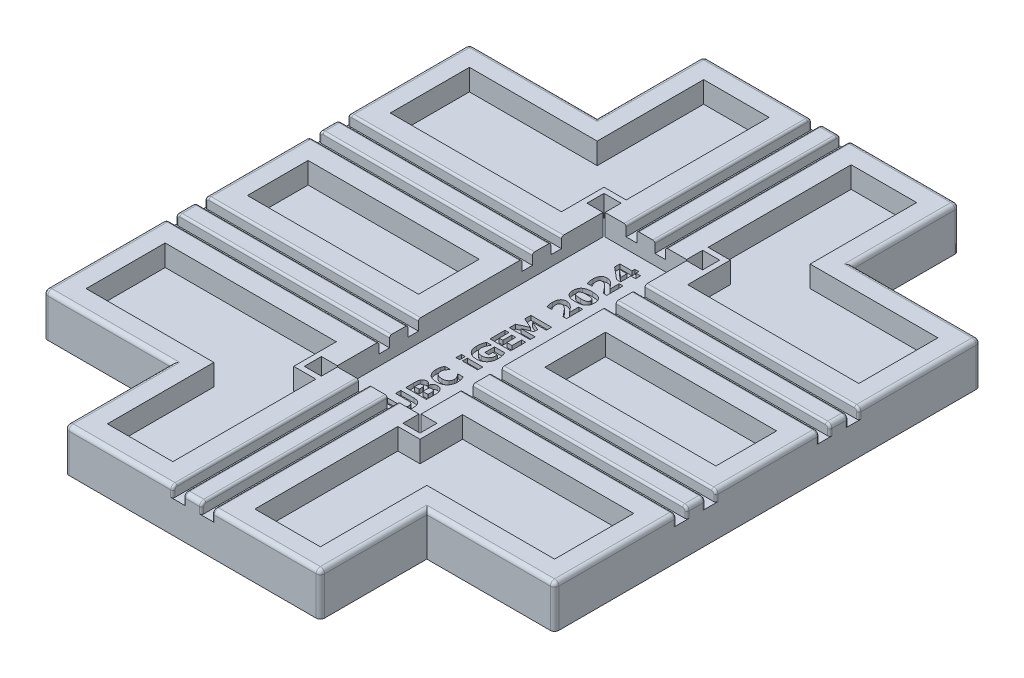
from build123d import *

# Parameters (mm, degrees)
SKETCH1_W                                  = 240
SKETCH1_H                                  = 200
BOSS_EXTRUDE1_DEPTH                        = 20
SKETCH7_W                                  = 120
SKETCH7_H                                  = 50
BOSS_EXTRUDE6_DEPTH                        = 20
FILLET1_R                                  = 2
SKETCH2_W                                  = 39.3
SKETCH2_H                                  = 125.7
CUT_EXTRUDE1_DEPTH                         = 10
CUT_EXTRUDE3_DEPTH                         = 5
MIRROR4_AT_THE_SECOND_PLANE_COPY_1_DEPTH   = 5
SKETCH11_W                                 = 104.748042719
SKETCH11_H                                 = 5
CUT_EXTRUDE4_DEPTH                         = 5
MIRROR6_AT_THE_SECOND_PLANE_COPY_1_SKETC_W = 104.748042719
MIRROR6_AT_THE_SECOND_PLANE_COPY_1_SKETC_H = 5
MIRROR6_AT_THE_SECOND_PLANE_COPY_1_DEPTH   = 5
SHELL1_START                               = 10
SHELL1_OUTLINE_W                           = 80.35
SHELL1_OUTLINE_H                           = 28.5
SHELL1_DEPTH                               = 10
FILLET3_R                                  = 1
SKETCH13_W                                 = 7.252545243
SKETCH13_H                                 = 2.335565418
SKETCH13_W_2                               = 1.720942939
SKETCH13_H_2                               = 2.581414408
CUT_EXTRUDE5_DEPTH                         = 2
CUT_EXTRUDE6_DEPTH                         = 10
MIRROR7_AT_THE_SECOND_PLANE_COPY_1_DEPTH   = 10


# Read off the part's stored shape, not the designer's step: Shell1
with BuildPart() as part:
    # Sketch1 → Boss-Extrude1 (new body)
    with BuildSketch(Plane(origin=(0, 0, 0), x_dir=(1, 0, 0), z_dir=(0, 1, 0))):
        Rectangle(SKETCH1_W, SKETCH1_H)
    extrude(amount=BOSS_EXTRUDE1_DEPTH)

    # Sketch7 → Boss-Extrude6 (add)
    with BuildSketch(Plane(origin=(0, 0, 0), x_dir=(1, 0, 0), z_dir=(0, 1, 0))):
        with Locations((0, 125)):
            Rectangle(SKETCH7_W, SKETCH7_H)
        with Locations((0, -125)):
            Rectangle(SKETCH7_W, SKETCH7_H)
    extrude(amount=BOSS_EXTRUDE6_DEPTH)

    # Fillet1
    fillet1_edges = [part.edges().sort_by_distance(p)[0] for p in [
        (-120, 20, 0),
        (90, 20, 100),
        (-90, 20, 100),
        (-60, 10, 150),
        (60, 10, 150),
        (-60, 20, 125),
        (0, 20, 150),
        (60, 20, 125),
        (-90, 20, -100),
        (60, 20, -125),
        (0, 20, -150),
        (60, 10, -150),
        (-60, 10, -150),
        (-60, 20, -125),
        (120, 20, 0),
        (120, 10, 100),
        (-120, 10, 100),
        (-120, 10, -100),
        (120, 10, -100),
        (90, 20, -100),
    ]]
    fillet(fillet1_edges, radius=FILLET1_R)

    # Sketch2 → Cut-Extrude1 (cut)
    with BuildSketch(Plane(origin=(0, 20, 0), x_dir=(1, 0, 0), z_dir=(0, 1, 0))):
        Rectangle(SKETCH2_W, SKETCH2_H)
    extrude(amount=-CUT_EXTRUDE1_DEPTH, mode=Mode.SUBTRACT)

    # Sketch10 → Cut-Extrude3 (cut)
    with BuildSketch(Plane(origin=(0, 20, 0), x_dir=(1, 0, 0), z_dir=(0, 1, 0))):
        Polygon((-9.25, -40.5), (-9.25, -33.162899401), (-4.25, -33.162899401), (-4.25, -40.5), (-4.25, -156.832928994), (-9.25, -156.832928994), align=None)
    cut_extrude3 = extrude(amount=-CUT_EXTRUDE3_DEPTH, mode=Mode.SUBTRACT)

    # Mirror4: Cut-Extrude3 across plane
    add(cut_extrude3.mirror(Plane(origin=(0, 0, 0), x_dir=(0, 0, 1), z_dir=(1, 0, 0))), mode=Mode.SUBTRACT)

    # Mirror4 at the second plane: Cut-Extrude3 across plane
    add(cut_extrude3.mirror(Plane.XY), mode=Mode.SUBTRACT)

    # Mirror4 at the second plane copy 1 sketc → Mirror4 at the second plane copy 1 (cut)
    with BuildSketch(Plane(origin=(0, 20, 0), x_dir=(-1, 0, 0), z_dir=(0, 1, 0))):
        Polygon((-9.25, -40.5), (-9.25, -33.162899401), (-4.25, -33.162899401), (-4.25, -40.5), (-4.25, -156.832928994), (-9.25, -156.832928994), align=None)
    extrude(amount=-MIRROR4_AT_THE_SECOND_PLANE_COPY_1_DEPTH, mode=Mode.SUBTRACT)

    # Sketch11 → Cut-Extrude4 (cut)
    with BuildSketch(Plane(origin=(0, 20, 0), x_dir=(1, 0, 0), z_dir=(0, 1, 0))):
        with Locations((-72.024021359, 26.75)):
            Rectangle(SKETCH11_W, SKETCH11_H)
        with Locations((-72.024021359, 40.35)):
            Rectangle(SKETCH11_W, SKETCH11_H)
    cut_extrude4 = extrude(amount=-CUT_EXTRUDE4_DEPTH, mode=Mode.SUBTRACT)

    # Mirror6: Cut-Extrude4 across plane
    add(cut_extrude4.mirror(Plane.XY), mode=Mode.SUBTRACT)

    # Mirror6 at the second plane: Cut-Extrude4 across plane
    add(cut_extrude4.mirror(Plane(origin=(0, 0, 0), x_dir=(0, 0, 1), z_dir=(1, 0, 0))), mode=Mode.SUBTRACT)

    # Mirror6 at the second plane copy 1 sketc → Mirror6 at the second plane copy 1 (cut)
    with BuildSketch(Plane(origin=(0, 20, 0), x_dir=(-1, 0, 0), z_dir=(0, 1, 0))):
        with Locations((-72.024021359, 26.75)):
            Rectangle(MIRROR6_AT_THE_SECOND_PLANE_COPY_1_SKETC_W, MIRROR6_AT_THE_SECOND_PLANE_COPY_1_SKETC_H)
        with Locations((-72.024021359, 40.35)):
            Rectangle(MIRROR6_AT_THE_SECOND_PLANE_COPY_1_SKETC_W, MIRROR6_AT_THE_SECOND_PLANE_COPY_1_SKETC_H)
    extrude(amount=-MIRROR6_AT_THE_SECOND_PLANE_COPY_1_DEPTH, mode=Mode.SUBTRACT)

    # Shell1 outline → Shell1 (cut)
    with BuildSketch(Plane(origin=(0, 0, 0), x_dir=(1, 0, 0), z_dir=(0, 1, 0)).offset(SHELL1_START)):
        Polygon((-29.65, 72.85), (-19.25, 72.85), (-19.25, 140), (-50, 140), (-50, 90), (-110, 90), (-110, 52.85), (-29.65, 52.85), align=None)
        Polygon((19.25, 72.85), (29.65, 72.85), (29.65, 52.85), (110, 52.85), (110, 90), (50, 90), (50, 140), (19.25, 140), align=None)
        Polygon((-110, -52.85), (-110, -90), (-50, -90), (-50, -140), (-19.25, -140), (-19.25, -72.85), (-29.65, -72.85), (-29.65, -52.85), align=None)
        with Locations((-69.825, 0)):
            Rectangle(SHELL1_OUTLINE_W, SHELL1_OUTLINE_H)
        Polygon((29.65, -72.85), (19.25, -72.85), (19.25, -140), (50, -140), (50, -90), (110, -90), (110, -52.85), (29.65, -52.85), align=None)
        with Locations((69.825, 0)):
            Rectangle(SHELL1_OUTLINE_W, SHELL1_OUTLINE_H)
    extrude(amount=SHELL1_DEPTH, mode=Mode.SUBTRACT)

    # Fillet3
    fillet3_edges = [part.edges().sort_by_distance(p)[0] for p in [
        (-4.25, 16.5, 150),
        (-4.25, 19.414213562, 149.414213562),
        (-9.25, 16.5, 150),
        (-9.25, 19.414213562, 149.414213562),
        (-4.25, 20, 105.425),
        (-9.25, 20, 105.425),
        (-9.25, 19.414213562, -149.414213562),
        (-9.25, 16.5, -150),
        (-9.25, 20, -105.425),
        (-4.25, 16.5, -150),
        (-4.25, 19.414213562, -149.414213562),
        (-4.25, 20, -105.425),
        (9.25, 16.5, 150),
        (9.25, 20, 105.425),
        (9.25, 19.414213562, 149.414213562),
        (4.25, 16.5, 150),
        (4.25, 19.414213562, 149.414213562),
        (4.25, 20, 105.425),
        (4.25, 16.5, -150),
        (4.25, 19.414213562, -149.414213562),
        (9.25, 19.414213562, -149.414213562),
        (9.25, 16.5, -150),
        (4.25, 20, -105.425),
        (9.25, 20, -105.425),
        (-120, 16.5, -24.25),
        (-120, 16.5, -29.25),
        (-119.414213562, 19.414213562, -24.25),
        (-119.414213562, 19.414213562, -29.25),
        (-68.825, 20, -24.25),
        (-68.825, 20, -29.25),
        (-120, 16.5, -37.85),
        (-120, 16.5, -42.85),
        (-68.825, 20, -37.85),
        (-68.825, 20, -42.85),
        (-119.414213562, 19.414213562, -37.85),
        (-119.414213562, 19.414213562, -42.85),
        (68.825, 20, -29.25),
        (119.414213562, 19.414213562, -29.25),
        (119.414213562, 19.414213562, -24.25),
        (68.825, 20, -24.25),
        (120, 16.5, -29.25),
        (120, 16.5, -24.25),
        (68.825, 20, -42.85),
        (119.414213562, 19.414213562, -42.85),
        (119.414213562, 19.414213562, -37.85),
        (68.825, 20, -37.85),
        (120, 16.5, -42.85),
        (120, 16.5, -37.85),
        (-120, 16.5, 29.25),
        (-120, 16.5, 24.25),
        (-68.825, 20, 29.25),
        (-119.414213562, 19.414213562, 29.25),
        (-119.414213562, 19.414213562, 24.25),
        (-68.825, 20, 24.25),
        (-120, 16.5, 42.85),
        (-120, 16.5, 37.85),
        (-68.825, 20, 42.85),
        (-119.414213562, 19.414213562, 42.85),
        (-119.414213562, 19.414213562, 37.85),
        (-68.825, 20, 37.85),
        (120, 16.5, 24.25),
        (120, 16.5, 29.25),
        (119.414213562, 19.414213562, 24.25),
        (119.414213562, 19.414213562, 29.25),
        (68.825, 20, 24.25),
        (68.825, 20, 29.25),
        (120, 16.5, 37.85),
        (120, 16.5, 42.85),
        (68.825, 20, 37.85),
        (68.825, 20, 42.85),
        (119.414213562, 19.414213562, 37.85),
        (119.414213562, 19.414213562, 42.85),
    ]]
    fillet(fillet3_edges, radius=FILLET3_R)

    # Sketch13 → Cut-Extrude5 (cut)
    # profile 1 of 12: a face of its own
    with BuildSketch(Plane(origin=(0, 10, 0), x_dir=(1, 0, 0), z_dir=(0, 1, 0))):
        Polygon((2.787359078, 56.729654742), (2.787359078, 55.37748529), (5, 55.37748529), (5, 53.041919872), (2.787359078, 53.041919872), (2.787359078, 48.247864542), (0.880108701, 48.247864542), (-4.711035156, 52.886343558), (-4.711035156, 55.37748529), (0.943491644, 55.37748529), (0.943491644, 56.729654742), align=None)
        Polygon((0.943491644, 53.041919872), (-2.596349692, 53.041919872), (0.943491644, 50.110938929), align=None, mode=Mode.SUBTRACT)
    # profile 2 of 12: a face of its own
    with BuildSketch(Plane(origin=(0, 10, 0), x_dir=(1, 0, 0), z_dir=(0, 1, 0))):
        with BuildLine():
            Line((5, 47.141544081), (5, 39.520225351))
            Line((5, 39.520225351), (3.409664338, 39.520225351))
            add(Edge.make_bspline(
                [(3.409664338, 39.520225351), (3.190599668, 39.81675512), (2.747057383, 40.417141716), (2.167094132, 41.14339637), (1.704390868, 41.703253096), (1.381972101, 42.083056551), (1.083256561, 42.417759603), (0.887687077, 42.622007507), (0.79559811, 42.718182933)],
                knots=[0, 0, 0, 0, 1.605452287, 3.25057426, 4.046675402, 4.768563423, 5.420146126, 6, 6, 6, 6], degree=3))
            add(Edge.make_bspline(
                [(0.79559811, 42.718182933), (0.732570292, 42.782561984), (0.609352585, 42.908421315), (0.423765416, 43.085974145), (0.244476812, 43.249198615), (0.074088064, 43.400664381), (-0.092796487, 43.534082219), (-0.252790737, 43.654099684), (-0.406497488, 43.759962438), (-0.599845109, 43.881290453), (-0.837875375, 44.00401532), (-1.125540586, 44.112139625), (-1.412736444, 44.178491494), (-1.604945873, 44.187117789), (-1.699385013, 44.191356186)],
                knots=[0, 0, 0, 0, 1.090093853, 2.131104457, 3.107135244, 4.023908394, 4.888948297, 5.691514549, 6.4435893, 7.146498757, 8.452673016, 9.675803408, 10.85804184, 12, 12, 12, 12], degree=3))
            add(Edge.make_bspline(
                [(-1.699385013, 44.191356186), (-1.754483363, 44.189605987), (-1.861179083, 44.186216799), (-2.017224671, 44.167846758), (-2.162681909, 44.132103765), (-2.300488192, 44.087839319), (-2.42643972, 44.024206924), (-2.544199113, 43.950411254), (-2.650531499, 43.859818439), (-2.749307162, 43.758726543), (-2.834556733, 43.642742478), (-2.911599654, 43.517157005), (-2.971430142, 43.377241787), (-3.024398474, 43.226819474), (-3.063653395, 43.063897589), (-3.092633036, 42.889340485), (-3.109905835, 42.703165878), (-3.111960528, 42.574807759), (-3.113016713, 42.508827152)],
                knots=[0, 0, 0, 0, 1.058578686, 2.049894692, 3.010224385, 3.931750511, 4.822578239, 5.71281177, 6.594427321, 7.498813824, 8.420995957, 9.353043897, 10.321837571, 11.3367408, 12.413304787, 13.535187771, 14.732999458, 16, 16, 16, 16], degree=3))
            add(Edge.make_bspline(
                [(-3.113016713, 42.508827152), (-3.110052719, 42.405568465), (-3.104041103, 42.196137688), (-3.053985994, 41.878413923), (-2.980602684, 41.552282773), (-2.873221808, 41.222921491), (-2.74714341, 40.895094854), (-2.596251992, 40.578640505), (-2.438170844, 40.269132893), (-2.314289691, 40.074405983), (-2.252545243, 39.977350819)],
                knots=[0, 0, 0, 0, 0.914703558, 1.855215137, 2.844920106, 3.875005138, 4.922433174, 5.955639304, 6.981056277, 8, 8, 8, 8], degree=3))
            Line((-2.252545243, 39.977350819), (-2.252545243, 39.766074342))
            Line((-2.252545243, 39.766074342), (-4.363389317, 39.766074342))
            add(Edge.make_bspline(
                [(-4.363389317, 39.766074342), (-4.396975153, 39.85152697), (-4.470639347, 40.038951181), (-4.568658946, 40.352153969), (-4.66491051, 40.720660415), (-4.763825821, 41.132864511), (-4.849735205, 41.573321973), (-4.910075419, 42.024211578), (-4.95119256, 42.474770211), (-4.954991729, 42.775713815), (-4.956884148, 42.92561802)],
                knots=[0, 0, 0, 0, 0.681686624, 1.495150967, 2.435076171, 3.509887788, 4.642826517, 5.765734475, 6.887081194, 8, 8, 8, 8], degree=3))
            add(Edge.make_bspline(
                [(-4.956884148, 42.92561802), (-4.954912362, 43.072306092), (-4.951074185, 43.357841566), (-4.914531776, 43.772464491), (-4.853049644, 44.160650299), (-4.769612134, 44.521836328), (-4.662431161, 44.856562797), (-4.529987596, 45.163893905), (-4.371768891, 45.443672956), (-4.191325, 45.69718541), (-3.986517109, 45.920499957), (-3.762299213, 46.116633841), (-3.516918106, 46.283180062), (-3.250583577, 46.417510178), (-2.964907945, 46.521931142), (-2.659732708, 46.596780352), (-2.333869778, 46.641015432), (-2.109911454, 46.646854566), (-1.995172081, 46.649846099)],
                knots=[0, 0, 0, 0, 1.302669921, 2.535710425, 3.693104205, 4.791067539, 5.825099944, 6.810730835, 7.758000335, 8.67487823, 9.568447078, 10.443087854, 11.315285082, 12.19521531, 13.085757283, 14.011200708, 14.981089066, 16, 16, 16, 16], degree=3))
            add(Edge.make_bspline(
                [(-1.995172081, 46.649846099), (-1.918295051, 46.648245135), (-1.764899121, 46.645050664), (-1.536586701, 46.623146341), (-1.311198259, 46.589276583), (-1.089189633, 46.538876948), (-0.870129482, 46.472993238), (-0.653296175, 46.39436831), (-0.439122967, 46.302496277), (-0.229338943, 46.193054838), (-0.018163961, 46.072147599), (0.191952814, 45.932794317), (0.405837655, 45.781094454), (0.620958688, 45.614342324), (0.835471411, 45.430057751), (1.055741697, 45.23549192), (1.273520634, 45.021368665), (1.417594688, 44.872241147), (1.490889788, 44.796375188)],
                knots=[0, 0, 0, 0, 0.907170522, 1.810115022, 2.704515666, 3.595334857, 4.494160497, 5.402400165, 6.316123003, 7.242010315, 8.19323076, 9.186549597, 10.215937183, 11.28746875, 12.397107329, 13.552885457, 14.755074217, 16, 16, 16, 16], degree=3))
            add(Edge.make_bspline(
                [(1.490889788, 44.796375188), (1.669671754, 44.600991906), (2.021428479, 44.216571794), (2.422503942, 43.720261203), (2.710127438, 43.347225494), (2.892573427, 43.11547907), (3.035611297, 42.923413887), (3.11966375, 42.809753418), (3.156132565, 42.760438229)],
                knots=[0, 0, 0, 0, 1.811045763, 3.563265038, 4.362127914, 5.033096026, 5.580478129, 6, 6, 6, 6], degree=3))
            Line((3.156132565, 42.760438229), (3.156132565, 47.141544081))
            Line((3.156132565, 47.141544081), (5, 47.141544081))
        make_face()
    # profile 3 of 12: a face of its own
    with BuildSketch(Plane(origin=(0, 10, 0), x_dir=(1, 0, 0), z_dir=(0, 1, 0))):
        with BuildLine():
            add(Edge.make_bspline(
                [(0.138720336, 37.553433421), (0.339837036, 37.551198694), (0.731017162, 37.546852061), (1.301575539, 37.503210957), (1.839727263, 37.435290008), (2.344336806, 37.340402007), (2.812295891, 37.218717557), (3.235819492, 37.059739443), (3.620265586, 36.877229499), (3.845547684, 36.720963882), (3.955141787, 36.64494457)],
                knots=[0, 0, 0, 0, 1.210994604, 2.355433537, 3.443919748, 4.476135166, 5.446013627, 6.351277171, 7.197937607, 8, 8, 8, 8], degree=3))
            add(Edge.make_bspline(
                [(3.955141787, 36.64494457), (4.057367971, 36.5617232), (4.260610648, 36.396265258), (4.524020765, 36.101981434), (4.745368417, 35.772676286), (4.897303004, 35.472877401), (4.999247268, 35.217133399), (5.063592063, 35.011802969), (5.122267484, 34.796985151), (5.167723638, 34.570405454), (5.201934481, 34.333084121), (5.226664862, 34.085073274), (5.242295446, 33.825562266), (5.244648027, 33.648682389), (5.245848991, 33.558387312)],
                knots=[0, 0, 0, 0, 1.363120718, 2.710110989, 4.070537742, 5.460816644, 6.180869889, 6.918733188, 7.687278466, 8.485437086, 9.309407483, 10.168795045, 11.065191617, 12, 12, 12, 12], degree=3))
            add(Edge.make_bspline(
                [(5.245848991, 33.558387312), (5.241905689, 33.384062955), (5.234297073, 33.047703496), (5.173081199, 32.562988904), (5.069699732, 32.118069919), (4.926806373, 31.711596248), (4.739854178, 31.34454147), (4.516760058, 31.013155063), (4.251279595, 30.717979546), (4.045332533, 30.554230832), (3.94169692, 30.471830054)],
                knots=[0, 0, 0, 0, 1.200851745, 2.317047666, 3.359233085, 4.342911255, 5.278031965, 6.189548012, 7.088953741, 8, 8, 8, 8], degree=3))
            add(Edge.make_bspline(
                [(3.94169692, 30.471830054), (3.829424185, 30.3947628), (3.600170882, 30.2373967), (3.214838014, 30.049115343), (2.792701976, 29.89168932), (2.331256748, 29.768085058), (1.834031119, 29.675388633), (1.301418942, 29.61187027), (0.734794995, 29.570336966), (0.344952566, 29.565716964), (0.144482422, 29.563341204)],
                knots=[0, 0, 0, 0, 0.822750793, 1.680001256, 2.58557045, 3.544707477, 4.565467581, 5.642347189, 6.787615291, 8, 8, 8, 8], degree=3))
            add(Edge.make_bspline(
                [(0.144482422, 29.563341204), (-0.061754837, 29.565532126), (-0.459970452, 29.569762495), (-1.036345286, 29.613069323), (-1.570746564, 29.680774054), (-2.065452333, 29.775711056), (-2.521358164, 29.900947264), (-2.938473361, 30.06222162), (-3.323134476, 30.249194002), (-3.55325365, 30.406272972), (-3.666176943, 30.483354226)],
                knots=[0, 0, 0, 0, 1.242237956, 2.39858964, 3.479780431, 4.485821505, 5.430991799, 6.32348679, 7.177307181, 8, 8, 8, 8], degree=3))
            add(Edge.make_bspline(
                [(-3.666176943, 30.483354226), (-3.769193286, 30.566416838), (-3.974708441, 30.732124775), (-4.238285133, 31.029639616), (-4.461065672, 31.362253167), (-4.645070962, 31.729678272), (-4.784115122, 32.135791847), (-4.885860052, 32.577168574), (-4.944671996, 33.056148657), (-4.952723667, 33.387282789), (-4.956884148, 33.558387312)],
                knots=[0, 0, 0, 0, 0.915406887, 1.826214983, 2.74012738, 3.682217607, 4.664024873, 5.706462388, 6.814877053, 8, 8, 8, 8], degree=3))
            add(Edge.make_bspline(
                [(-4.956884148, 33.558387312), (-4.955682618, 33.64868302), (-4.953320425, 33.826203271), (-4.937576888, 34.086978277), (-4.913381513, 34.337057391), (-4.877300412, 34.575699285), (-4.828262853, 34.80214551), (-4.773499009, 35.018778584), (-4.706561244, 35.224310597), (-4.601886899, 35.480626422), (-4.447267393, 35.781827029), (-4.217150947, 36.109134402), (-3.948246131, 36.405401156), (-3.739143401, 36.569659884), (-3.633525124, 36.652627351)],
                knots=[0, 0, 0, 0, 0.927772364, 1.823989051, 2.683453821, 3.508702832, 4.302191287, 5.063276402, 5.803871599, 6.520953588, 7.906777029, 9.27188215, 10.622021304, 12, 12, 12, 12], degree=3))
            add(Edge.make_bspline(
                [(-3.633525124, 36.652627351), (-3.521300204, 36.729189524), (-3.292789343, 36.885084383), (-2.908970475, 37.068290297), (-2.492360426, 37.225455121), (-2.036263275, 37.346342452), (-1.54437137, 37.439204828), (-1.015826808, 37.505677425), (-0.450933502, 37.546286922), (-0.061742996, 37.551003841), (0.138720336, 37.553433421)],
                knots=[0, 0, 0, 0, 0.826423845, 1.682753026, 2.582377666, 3.535958882, 4.552416628, 5.629628825, 6.779074777, 8, 8, 8, 8], degree=3))
        make_face()
        with BuildLine():
            add(Edge.make_bspline(
                [(0.138720336, 35.094943508), (-0.002794049, 35.093990238), (-0.275052116, 35.092156251), (-0.667644343, 35.074004214), (-1.028464631, 35.048543297), (-1.357952356, 35.010483072), (-1.656192237, 34.961169576), (-1.923473104, 34.900935006), (-2.158488294, 34.828227196), (-2.363936988, 34.745989678), (-2.54162794, 34.64913888), (-2.69467252, 34.537908006), (-2.823572221, 34.410664927), (-2.931286275, 34.270097317), (-3.011274034, 34.111739825), (-3.072443859, 33.941187009), (-3.106785969, 33.754382189), (-3.110895684, 33.625106618), (-3.113016713, 33.558387312)],
                knots=[0, 0, 0, 0, 1.684598718, 3.240982106, 4.677870026, 5.990101975, 7.188004416, 8.275163324, 9.249099904, 10.113910365, 10.905306099, 11.652292794, 12.358339015, 13.054983843, 13.750418457, 14.461547751, 15.206002611, 16, 16, 16, 16], degree=3))
            add(Edge.make_bspline(
                [(-3.113016713, 33.558387312), (-3.110895681, 33.491668012), (-3.106785962, 33.362392453), (-3.072443884, 33.175587552), (-3.011273943, 33.005035023), (-2.931286606, 32.84667649), (-2.823570979, 32.706112772), (-2.694677343, 32.578854684), (-2.541608299, 32.467684345), (-2.363496496, 32.37029911), (-2.157013742, 32.289020864), (-1.921590867, 32.215742751), (-1.654258135, 32.155647372), (-1.355414385, 32.106122047), (-1.024612933, 32.068276855), (-0.661244964, 32.04269777), (-0.266085327, 32.024665897), (0.008090715, 32.022799039), (0.150244508, 32.021831116)],
                knots=[0, 0, 0, 0, 0.791766581, 1.534129826, 2.243261137, 2.936741863, 3.631429404, 4.335491923, 5.08037989, 5.869552125, 6.738971147, 7.710171362, 8.794275798, 9.988812621, 11.304907075, 12.745337551, 14.312534512, 16, 16, 16, 16], degree=3))
            add(Edge.make_bspline(
                [(0.150244508, 32.021831116), (0.289201434, 32.022765136), (0.556986265, 32.024565091), (0.943773412, 32.043063349), (1.30096878, 32.067483158), (1.627502144, 32.109075315), (1.924420257, 32.156514098), (2.190195476, 32.220950105), (2.427221865, 32.292197549), (2.635687527, 32.376524358), (2.816464841, 32.475577579), (2.974492505, 32.586386469), (3.106149375, 32.714997304), (3.215613674, 32.855867424), (3.298888327, 33.012083539), (3.358752163, 33.181622444), (3.396338685, 33.365314373), (3.400067537, 33.492898418), (3.401981557, 33.558387312)],
                knots=[0, 0, 0, 0, 1.658832269, 3.196746878, 4.622488866, 5.931787449, 7.125569234, 8.210133994, 9.194149195, 10.078471196, 10.889203548, 11.650697572, 12.375032472, 13.07829054, 13.77251817, 14.478471121, 15.218999177, 16, 16, 16, 16], degree=3))
            add(Edge.make_bspline(
                [(3.401981557, 33.558387312), (3.400068186, 33.623876875), (3.3963406, 33.751462223), (3.358745104, 33.935144911), (3.298913291, 34.10471679), (3.215521541, 34.260812329), (3.106775331, 34.40178813), (2.97377315, 34.528364287), (2.816557237, 34.639341559), (2.635707586, 34.738476019), (2.42683161, 34.821967534), (2.190341985, 34.897522561), (1.921851262, 34.956560743), (1.624132619, 35.009519497), (1.295502071, 35.045529443), (0.936895825, 35.074962985), (0.547988509, 35.091838226), (0.278306115, 35.093884415), (0.138720336, 35.094943508)],
                knots=[0, 0, 0, 0, 0.778971247, 1.517574904, 2.221693305, 2.914116855, 3.615547377, 4.332711038, 5.092226179, 5.900851692, 6.782875619, 7.766611013, 8.854037796, 10.053520173, 11.366075456, 12.788704916, 14.337855446, 16, 16, 16, 16], degree=3))
        make_face(mode=Mode.SUBTRACT)
    # profile 4 of 12: a face of its own
    with BuildSketch(Plane(origin=(0, 10, 0), x_dir=(1, 0, 0), z_dir=(0, 1, 0))):
        with BuildLine():
            Line((5, 28.211171751), (5, 20.589853021))
            Line((5, 20.589853021), (3.409664338, 20.589853021))
            add(Edge.make_bspline(
                [(3.409664338, 20.589853021), (3.190599668, 20.88638279), (2.747057383, 21.486769386), (2.167094132, 22.21302404), (1.704390868, 22.772880767), (1.381972101, 23.152684221), (1.083256561, 23.487387273), (0.887687077, 23.691635177), (0.79559811, 23.787810603)],
                knots=[0, 0, 0, 0, 1.605452287, 3.25057426, 4.046675402, 4.768563423, 5.420146126, 6, 6, 6, 6], degree=3))
            add(Edge.make_bspline(
                [(0.79559811, 23.787810603), (0.732570292, 23.852189654), (0.609352585, 23.978048985), (0.423765416, 24.155601815), (0.244476812, 24.318826285), (0.074088064, 24.470292051), (-0.092796487, 24.60370989), (-0.252790737, 24.723727355), (-0.406497488, 24.829590108), (-0.599845109, 24.950918123), (-0.837875375, 25.07364299), (-1.125540586, 25.181767295), (-1.412736444, 25.248119164), (-1.604945873, 25.256745459), (-1.699385013, 25.260983856)],
                knots=[0, 0, 0, 0, 1.090093853, 2.131104457, 3.107135244, 4.023908394, 4.888948297, 5.691514549, 6.4435893, 7.146498757, 8.452673016, 9.675803408, 10.85804184, 12, 12, 12, 12], degree=3))
            add(Edge.make_bspline(
                [(-1.699385013, 25.260983856), (-1.754483363, 25.259233658), (-1.861179083, 25.25584447), (-2.017224671, 25.237474428), (-2.162681909, 25.201731435), (-2.300488192, 25.157466989), (-2.42643972, 25.093834595), (-2.544199113, 25.020038924), (-2.650531499, 24.929446109), (-2.749307162, 24.828354213), (-2.834556733, 24.712370148), (-2.911599654, 24.586784675), (-2.971430142, 24.446869457), (-3.024398474, 24.296447144), (-3.063653395, 24.133525259), (-3.092633036, 23.958968155), (-3.109905835, 23.772793548), (-3.111960528, 23.644435429), (-3.113016713, 23.578454822)],
                knots=[0, 0, 0, 0, 1.058578686, 2.049894692, 3.010224385, 3.931750511, 4.822578239, 5.71281177, 6.594427321, 7.498813824, 8.420995957, 9.353043897, 10.321837571, 11.3367408, 12.413304787, 13.535187771, 14.732999458, 16, 16, 16, 16], degree=3))
            add(Edge.make_bspline(
                [(-3.113016713, 23.578454822), (-3.110052719, 23.475196136), (-3.104041103, 23.265765358), (-3.053985994, 22.948041593), (-2.980602684, 22.621910443), (-2.873221808, 22.292549161), (-2.74714341, 21.964722525), (-2.596251992, 21.648268175), (-2.438170844, 21.338760563), (-2.314289691, 21.144033653), (-2.252545243, 21.046978489)],
                knots=[0, 0, 0, 0, 0.914703558, 1.855215137, 2.844920106, 3.875005138, 4.922433174, 5.955639304, 6.981056277, 8, 8, 8, 8], degree=3))
            Line((-2.252545243, 21.046978489), (-2.252545243, 20.835702012))
            Line((-2.252545243, 20.835702012), (-4.363389317, 20.835702012))
            add(Edge.make_bspline(
                [(-4.363389317, 20.835702012), (-4.396975153, 20.92115464), (-4.470639347, 21.108578851), (-4.568658946, 21.421781639), (-4.66491051, 21.790288086), (-4.763825821, 22.202492181), (-4.849735205, 22.642949643), (-4.910075419, 23.093839248), (-4.95119256, 23.544397881), (-4.954991729, 23.845341485), (-4.956884148, 23.99524569)],
                knots=[0, 0, 0, 0, 0.681686624, 1.495150967, 2.435076171, 3.509887788, 4.642826517, 5.765734475, 6.887081194, 8, 8, 8, 8], degree=3))
            add(Edge.make_bspline(
                [(-4.956884148, 23.99524569), (-4.954912362, 24.141933762), (-4.951074185, 24.427469237), (-4.914531776, 24.842092162), (-4.853049644, 25.230277969), (-4.769612134, 25.591463998), (-4.662431161, 25.926190468), (-4.529987596, 26.233521576), (-4.371768891, 26.513300626), (-4.191325, 26.76681308), (-3.986517109, 26.990127627), (-3.762299213, 27.186261512), (-3.516918106, 27.352807733), (-3.250583577, 27.487137848), (-2.964907945, 27.591558812), (-2.659732708, 27.666408023), (-2.333869778, 27.710643103), (-2.109911454, 27.716482236), (-1.995172081, 27.719473769)],
                knots=[0, 0, 0, 0, 1.302669921, 2.535710425, 3.693104205, 4.791067539, 5.825099944, 6.810730835, 7.758000335, 8.67487823, 9.568447078, 10.443087854, 11.315285082, 12.19521531, 13.085757283, 14.011200708, 14.981089066, 16, 16, 16, 16], degree=3))
            add(Edge.make_bspline(
                [(-1.995172081, 27.719473769), (-1.918295051, 27.717872805), (-1.764899121, 27.714678334), (-1.536586701, 27.692774011), (-1.311198259, 27.658904253), (-1.089189633, 27.608504619), (-0.870129482, 27.542620908), (-0.653296175, 27.46399598), (-0.439122967, 27.372123947), (-0.229338943, 27.262682508), (-0.018163961, 27.141775269), (0.191952814, 27.002421987), (0.405837655, 26.850722124), (0.620958688, 26.683969994), (0.835471411, 26.499685422), (1.055741697, 26.30511959), (1.273520634, 26.090996335), (1.417594688, 25.941868817), (1.490889788, 25.866002858)],
                knots=[0, 0, 0, 0, 0.907170522, 1.810115022, 2.704515666, 3.595334857, 4.494160497, 5.402400165, 6.316123003, 7.242010315, 8.19323076, 9.186549597, 10.215937183, 11.28746875, 12.397107329, 13.552885457, 14.755074217, 16, 16, 16, 16], degree=3))
            add(Edge.make_bspline(
                [(1.490889788, 25.866002858), (1.669671754, 25.670619576), (2.021428479, 25.286199464), (2.422503942, 24.789888873), (2.710127438, 24.416853164), (2.892573427, 24.18510674), (3.035611297, 23.993041557), (3.11966375, 23.879381088), (3.156132565, 23.830065899)],
                knots=[0, 0, 0, 0, 1.811045763, 3.563265038, 4.362127914, 5.033096026, 5.580478129, 6, 6, 6, 6], degree=3))
            Line((3.156132565, 23.830065899), (3.156132565, 28.211171751))
            Line((3.156132565, 28.211171751), (5, 28.211171751))
        make_face()
    # profile 5 of 12: a face of its own
    with BuildSketch(Plane(origin=(0, 10, 0), x_dir=(1, 0, 0), z_dir=(0, 1, 0))):
        Polygon((5, 13.583156769), (5, 11.124666856), (-1.524601746, 11.124666856), (2.664434583, 9.338420279), (2.664434583, 7.625160121), (-1.524601746, 5.838913543), (5, 5.838913543), (5, 3.503348126), (-4.711035156, 3.503348126), (-4.711035156, 6.382470298), (0.125275469, 8.549014533), (-4.711035156, 10.709796683), (-4.711035156, 13.583156769), align=None)
    # profile 6 of 12: a face of its own
    with BuildSketch(Plane(origin=(0, 10, 0), x_dir=(1, 0, 0), z_dir=(0, 1, 0))):
        Polygon((5, 1.4136317), (5, -5.593064552), (-4.711035156, -5.593064552), (-4.711035156, 1.4136317), (-2.867167722, 1.4136317), (-2.867167722, -3.134574639), (-1.146224782, -3.134574639), (-1.146224782, 1.044858213), (0.697642652, 1.044858213), (0.697642652, -3.134574639), (3.156132565, -3.134574639), (3.156132565, 1.4136317), align=None)
    # profile 7 of 12: a face of its own
    with BuildSketch(Plane(origin=(0, 10, 0), x_dir=(1, 0, 0), z_dir=(0, 1, 0))):
        with BuildLine():
            add(Edge.make_bspline(
                [(4.475650198, -7.805705474), (4.519354839, -7.923859504), (4.612512661, -8.17570855), (4.743574124, -8.583890089), (4.866671289, -9.047274178), (4.996208031, -9.552124696), (5.106381276, -10.084227717), (5.187397941, -10.625264318), (5.237323662, -11.165972628), (5.243010567, -11.526628491), (5.245848991, -11.706637515)],
                knots=[0, 0, 0, 0, 0.756485239, 1.612472169, 2.573171414, 3.635272123, 4.742182008, 5.834553763, 6.919191659, 8, 8, 8, 8], degree=3))
            add(Edge.make_bspline(
                [(5.245848991, -11.706637515), (5.241962961, -11.909112321), (5.234392087, -12.303579456), (5.17063924, -12.878829296), (5.062937634, -13.419584917), (4.916847086, -13.928231287), (4.72267015, -14.400885619), (4.491042888, -14.842463027), (4.211679163, -15.247896521), (3.893490591, -15.618759753), (3.53655883, -15.9505899), (3.145758166, -16.239699566), (2.72146993, -16.48347792), (2.264846611, -16.681095463), (1.776896349, -16.838089964), (1.255150105, -16.944841813), (0.702111097, -17.014888699), (0.322052776, -17.021601157), (0.127196165, -17.025042647)],
                knots=[0, 0, 0, 0, 1.160705024, 2.261318311, 3.313123859, 4.319096107, 5.290496718, 6.238021168, 7.172737693, 8.107230733, 9.03451477, 9.961071912, 10.888559376, 11.833805606, 12.808979065, 13.821966168, 14.883317984, 16, 16, 16, 16], degree=3))
            add(Edge.make_bspline(
                [(0.127196165, -17.025042647), (-0.058682323, -17.02067815), (-0.422730133, -17.012130168), (-0.955049114, -16.943336637), (-1.460067022, -16.832867692), (-1.937766829, -16.677677821), (-2.386372436, -16.473696921), (-2.808700267, -16.227656485), (-3.203463564, -15.935836699), (-3.565000576, -15.598836264), (-3.895700628, -15.226075236), (-4.177610929, -14.810267907), (-4.422741814, -14.363406013), (-4.616779655, -13.8775432), (-4.772219277, -13.359136807), (-4.876169413, -12.804694831), (-4.946971316, -12.216810998), (-4.953520434, -11.812500101), (-4.956884148, -11.604840667)],
                knots=[0, 0, 0, 0, 1.061573339, 2.079118747, 3.060574866, 4.011305467, 4.942696719, 5.870461571, 6.798745348, 7.740825567, 8.68941507, 9.638984161, 10.604583371, 11.595514188, 12.621960228, 13.691449096, 14.814297672, 16, 16, 16, 16], degree=3))
            add(Edge.make_bspline(
                [(-4.956884148, -11.604840667), (-4.954318925, -11.445386322), (-4.949235323, -11.129389392), (-4.919388643, -10.661251886), (-4.863951384, -10.205248288), (-4.792453594, -9.753475749), (-4.684946461, -9.294730481), (-4.534849919, -8.818874824), (-4.346707534, -8.316660693), (-4.193287983, -7.980233106), (-4.113698935, -7.805705474)],
                knots=[0, 0, 0, 0, 0.974479143, 1.931163549, 2.86485946, 3.780778834, 4.725046501, 5.741022375, 6.828116267, 8, 8, 8, 8], degree=3))
            Line((-4.113698935, -7.805705474), (-1.883771756, -7.805705474))
            Line((-1.883771756, -7.805705474), (-1.883771756, -8.091889065))
            add(Edge.make_bspline(
                [(-1.883771756, -8.091889065), (-1.906716104, -8.126531064), (-1.957410079, -8.203070203), (-2.043059993, -8.326945943), (-2.137489474, -8.476111594), (-2.284548962, -8.694884397), (-2.45960062, -8.978067997), (-2.581693909, -9.213466955), (-2.640525683, -9.326896107)],
                knots=[0, 0, 0, 0, 0.515980687, 1.140024195, 1.869947604, 2.707876564, 4.413660046, 6, 6, 6, 6], degree=3))
            add(Edge.make_bspline(
                [(-2.640525683, -9.326896107), (-2.672756546, -9.393740863), (-2.73882048, -9.530753251), (-2.823836627, -9.749019276), (-2.905177649, -9.981830174), (-2.978097, -10.22950925), (-3.037034138, -10.489919732), (-3.082413494, -10.759686706), (-3.106467195, -11.03779789), (-3.110821171, -11.225783758), (-3.113016713, -11.320577771)],
                knots=[0, 0, 0, 0, 0.861448091, 1.765719082, 2.717953576, 3.724891765, 4.761927522, 5.816719679, 6.89905606, 8, 8, 8, 8], degree=3))
            add(Edge.make_bspline(
                [(-3.113016713, -11.320577771), (-3.110164997, -11.430782772), (-3.104578279, -11.646682304), (-3.068710383, -11.963218824), (-3.004292393, -12.263584213), (-2.918860854, -12.549882667), (-2.805175217, -12.820581595), (-2.662381265, -13.075068024), (-2.499039638, -13.320076357), (-2.36711736, -13.466852812), (-2.300562624, -13.540901474)],
                knots=[0, 0, 0, 0, 1.091217493, 2.137773647, 3.148547478, 4.129133693, 5.092188092, 6.048375109, 7.015406034, 8, 8, 8, 8], degree=3))
            add(Edge.make_bspline(
                [(-2.300562624, -13.540901474), (-2.231129169, -13.608753509), (-2.090799964, -13.745886571), (-1.846186727, -13.91943259), (-1.579009792, -14.07619004), (-1.283734201, -14.208811415), (-0.962723927, -14.314570988), (-0.616833633, -14.387928819), (-0.248028071, -14.435679856), (0.006035391, -14.440927383), (0.136799641, -14.443628239)],
                knots=[0, 0, 0, 0, 0.871242595, 1.760833901, 2.686460846, 3.652134751, 4.663748384, 5.717797841, 6.825370436, 8, 8, 8, 8], degree=3))
            add(Edge.make_bspline(
                [(0.136799641, -14.443628239), (0.270078203, -14.441217619), (0.528956778, -14.436535262), (0.904701948, -14.395518364), (1.257245759, -14.329288021), (1.585144219, -14.233472949), (1.889752999, -14.11198958), (2.170660406, -13.964565335), (2.424839249, -13.78559248), (2.657673098, -13.584235453), (2.862193118, -13.352834409), (3.041867765, -13.096983341), (3.191530728, -12.813783401), (3.315763592, -12.506455713), (3.407777269, -12.172177215), (3.477785429, -11.813452581), (3.51753353, -11.428392977), (3.522401475, -11.163169785), (3.524906052, -11.026711399)],
                knots=[0, 0, 0, 0, 1.162877018, 2.258757441, 3.29433279, 4.289818334, 5.235063129, 6.152415668, 7.05144509, 7.94239879, 8.832861761, 9.739671241, 10.664582224, 11.622279774, 12.626959197, 13.685538709, 14.809200461, 16, 16, 16, 16], degree=3))
            add(Edge.make_bspline(
                [(3.524906052, -11.026711399), (3.524545414, -10.976125561), (3.523787414, -10.869802624), (3.51698298, -10.707868976), (3.511542352, -10.544994826), (3.50110347, -10.438303115), (3.496095624, -10.387119882)],
                knots=[0, 0, 0, 0, 0.947728294, 1.991965744, 3.036685378, 4, 4, 4, 4], degree=3))
            Line((3.496095624, -10.387119882), (1.435189626, -10.387119882))
            Line((1.435189626, -10.387119882), (1.435189626, -12.353911813))
            Line((1.435189626, -12.353911813), (-0.408677809, -12.353911813))
            Line((-0.408677809, -12.353911813), (-0.408677809, -7.805705474))
            Line((-0.408677809, -7.805705474), (4.475650198, -7.805705474))
        make_face()
    # profile 8 of 12: a face of its own
    with BuildSketch(Plane(origin=(0, 10, 0), x_dir=(1, 0, 0), z_dir=(0, 1, 0))):
        with Locations((1.373727378, -19.913768295)):
            Rectangle(SKETCH13_W, SKETCH13_H)
    # profile 9 of 12: a face of its own
    with BuildSketch(Plane(origin=(0, 10, 0), x_dir=(1, 0, 0), z_dir=(0, 1, 0))):
        with Locations((-4.219337174, -19.913768295)):
            Rectangle(SKETCH13_W_2, SKETCH13_H_2)
    # profile 10 of 12: a face of its own
    with BuildSketch(Plane(origin=(0, 10, 0), x_dir=(1, 0, 0), z_dir=(0, 1, 0))):
        with BuildLine():
            add(Edge.make_bspline(
                [(5.245848991, -30.773379208), (5.241556228, -30.949600555), (5.233101922, -31.296656552), (5.17328717, -31.807137753), (5.071443943, -32.296870987), (4.929457053, -32.76358831), (4.750483589, -33.205121013), (4.527408056, -33.614715808), (4.267338932, -33.994815031), (4.061606502, -34.220067298), (3.958983177, -34.332427496)],
                knots=[0, 0, 0, 0, 1.089850102, 2.146385891, 3.173869964, 4.179760968, 5.160008291, 6.115072822, 7.059761785, 8, 8, 8, 8], degree=3))
            add(Edge.make_bspline(
                [(3.958983177, -34.332427496), (3.848038568, -34.438295465), (3.624492228, -34.651612698), (3.240912088, -34.92404395), (2.819806379, -35.161121156), (2.440058042, -35.326067869), (2.118408243, -35.437370727), (1.865302565, -35.510926057), (1.602961267, -35.571890876), (1.331038558, -35.621175666), (1.050675199, -35.662875321), (0.76008365, -35.687900337), (0.460358885, -35.70657835), (0.257194686, -35.708560179), (0.154085898, -35.709565986)],
                knots=[0, 0, 0, 0, 1.326589366, 2.672993315, 4.060770367, 5.505883836, 6.25107509, 7.007321983, 7.7873399, 8.582269437, 9.400071632, 10.240855478, 11.107208546, 12, 12, 12, 12], degree=3))
            add(Edge.make_bspline(
                [(0.154085898, -35.709565986), (-0.036260272, -35.705853317), (-0.409159179, -35.698579988), (-0.954067146, -35.631518817), (-1.472101576, -35.524248732), (-1.962272567, -35.375865598), (-2.421254864, -35.182794221), (-2.847342954, -34.951680217), (-3.242424741, -34.683652344), (-3.47520079, -34.471076121), (-3.591269829, -34.365079315)],
                knots=[0, 0, 0, 0, 1.119324668, 2.1928203, 3.223958197, 4.228260008, 5.200520162, 6.147632129, 7.076354466, 8, 8, 8, 8], degree=3))
            add(Edge.make_bspline(
                [(-3.591269829, -34.365079315), (-3.696426816, -34.256022231), (-3.907914238, -34.036691095), (-4.17855444, -33.660997219), (-4.413868173, -33.249571895), (-4.610724175, -32.802820982), (-4.765892728, -32.325941651), (-4.877010675, -31.82562766), (-4.943259501, -31.303347455), (-4.952287649, -30.948354573), (-4.956884148, -30.767617122)],
                knots=[0, 0, 0, 0, 0.919195442, 1.8486482, 2.803167129, 3.793795735, 4.808307604, 5.844199062, 6.902417522, 8, 8, 8, 8], degree=3))
            add(Edge.make_bspline(
                [(-4.956884148, -30.767617122), (-4.956393428, -30.668359933), (-4.955436829, -30.474869682), (-4.94084827, -30.191814102), (-4.921289403, -29.923828157), (-4.879474294, -29.592200908), (-4.814808823, -29.204474119), (-4.7421777, -28.904822537), (-4.707193766, -28.760490591)],
                knots=[0, 0, 0, 0, 0.880714095, 1.716848845, 2.514717796, 3.264532192, 4.682418473, 6, 6, 6, 6], degree=3))
            add(Edge.make_bspline(
                [(-4.707193766, -28.760490591), (-4.664108705, -28.621612355), (-4.581310973, -28.354726269), (-4.434982607, -27.98111963), (-4.28414942, -27.652264541), (-4.186257609, -27.446632632), (-4.140588669, -27.350700282)],
                knots=[0, 0, 0, 0, 1.146660616, 2.203568899, 3.161920647, 4, 4, 4, 4], degree=3))
            Line((-4.140588669, -27.350700282), (-1.760847261, -27.350700282))
            Line((-1.760847261, -27.350700282), (-1.760847261, -27.636883873))
            add(Edge.make_bspline(
                [(-1.760847261, -27.636883873), (-1.789760882, -27.669445598), (-1.850028949, -27.737317837), (-1.943169449, -27.84646079), (-2.044289807, -27.966859077), (-2.193791638, -28.146156267), (-2.382825876, -28.396964235), (-2.52216278, -28.612309765), (-2.594428997, -28.723997382)],
                knots=[0, 0, 0, 0, 0.571444814, 1.191129738, 1.882836886, 2.634784766, 4.254652092, 6, 6, 6, 6], degree=3))
            add(Edge.make_bspline(
                [(-2.594428997, -28.723997382), (-2.664236929, -28.846886536), (-2.805685787, -29.09589163), (-2.943550161, -29.429418426), (-3.032587435, -29.709146116), (-3.077362003, -29.929392289), (-3.107853006, -30.156624515), (-3.111280534, -30.311028434), (-3.113016713, -30.389240159)],
                knots=[0, 0, 0, 0, 1.439173741, 2.916136845, 3.667290802, 4.427345131, 5.203387771, 6, 6, 6, 6], degree=3))
            add(Edge.make_bspline(
                [(-3.113016713, -30.389240159), (-3.110477824, -30.475745648), (-3.105440763, -30.647369353), (-3.07497042, -30.902187581), (-3.020147889, -31.150575186), (-2.946619655, -31.393340851), (-2.845477271, -31.627774464), (-2.718252775, -31.853674636), (-2.562057311, -32.070037457), (-2.439651919, -32.20231689), (-2.377390434, -32.269600803)],
                knots=[0, 0, 0, 0, 1.001598119, 1.9871338, 2.96553644, 3.943152672, 4.919306753, 5.914963555, 6.939446524, 8, 8, 8, 8], degree=3))
            add(Edge.make_bspline(
                [(-2.377390434, -32.269600803), (-2.309583745, -32.332034441), (-2.171025631, -32.45961311), (-1.93152049, -32.625206542), (-1.660665123, -32.770051169), (-1.360441958, -32.900067806), (-1.026703819, -33.004078191), (-0.659549693, -33.075068855), (-0.259970233, -33.119887624), (0.017588233, -33.125326369), (0.161768679, -33.128151577)],
                knots=[0, 0, 0, 0, 0.80388915, 1.642689914, 2.53299325, 3.481872775, 4.4947599, 5.577680681, 6.741702658, 8, 8, 8, 8], degree=3))
            add(Edge.make_bspline(
                [(0.161768679, -33.128151577), (0.311768837, -33.125923628), (0.599876693, -33.121644368), (1.011428999, -33.069407329), (1.386636838, -32.994288328), (1.721395513, -32.879071876), (2.020823568, -32.741957475), (2.287301408, -32.588864868), (2.521133588, -32.418332338), (2.653723475, -32.287257692), (2.71821405, -32.223504117)],
                knots=[0, 0, 0, 0, 1.290334302, 2.478367041, 3.565730986, 4.578276722, 5.517838544, 6.396912514, 7.220272109, 8, 8, 8, 8], degree=3))
            add(Edge.make_bspline(
                [(2.71821405, -32.223504117), (2.776624204, -32.15678903), (2.892154246, -32.024832576), (3.038823686, -31.808811236), (3.156499876, -31.579934787), (3.248205125, -31.341825956), (3.315689405, -31.098752861), (3.366730598, -30.856410279), (3.396189151, -30.615336617), (3.400060024, -30.45525906), (3.401981557, -30.375795292)],
                knots=[0, 0, 0, 0, 1.054325691, 2.085361559, 3.097224921, 4.110091334, 5.115626892, 6.095649915, 7.054665517, 8, 8, 8, 8], degree=3))
            add(Edge.make_bspline(
                [(3.401981557, -30.375795292), (3.399995416, -30.300167635), (3.396010997, -30.148450175), (3.367969377, -29.92183692), (3.324531763, -29.696128902), (3.260202951, -29.473850088), (3.18176618, -29.256712893), (3.091757836, -29.045457401), (2.985752349, -28.843934907), (2.905928292, -28.715220777), (2.866107583, -28.651010962)],
                knots=[0, 0, 0, 0, 0.991289386, 1.988636345, 2.989438367, 4.001683697, 5.01851186, 6.01479875, 7.009670459, 8, 8, 8, 8], degree=3))
            add(Edge.make_bspline(
                [(2.866107583, -28.651010962), (2.799086235, -28.54754028), (2.667016335, -28.343644611), (2.482727048, -28.10690862), (2.33514417, -27.932313621), (2.23417018, -27.813138173), (2.139586208, -27.707238781), (2.078704196, -27.641290482), (2.049812104, -27.60999414)],
                knots=[0, 0, 0, 0, 1.674278229, 3.299273488, 4.071081905, 4.780574956, 5.421311183, 6, 6, 6, 6], degree=3))
            Line((2.049812104, -27.60999414), (2.049812104, -27.350700282))
            Line((2.049812104, -27.350700282), (4.400743084, -27.350700282))
            add(Edge.make_bspline(
                [(4.400743084, -27.350700282), (4.453977989, -27.469107265), (4.557995254, -27.700466195), (4.710217804, -28.043257711), (4.853488894, -28.385337096), (4.925202683, -28.621478965), (4.961586095, -28.741283639)],
                knots=[0, 0, 0, 0, 1.037949104, 2.028079651, 2.999562103, 4, 4, 4, 4], degree=3))
            add(Edge.make_bspline(
                [(4.961586095, -28.741283639), (5.004421769, -28.893824294), (5.086847599, -29.1873481), (5.164067273, -29.560966602), (5.209771736, -29.869797121), (5.23105018, -30.136648007), (5.244470102, -30.442236078), (5.245371714, -30.658760047), (5.245848991, -30.773379208)],
                knots=[0, 0, 0, 0, 1.383532347, 2.662238992, 3.328886368, 4.109040656, 4.999001483, 6, 6, 6, 6], degree=3))
        make_face()
    # profile 11 of 12: a face of its own
    with BuildSketch(Plane(origin=(0, 10, 0), x_dir=(1, 0, 0), z_dir=(0, 1, 0))):
        with BuildLine():
            add(Edge.make_bspline(
                [(2.021001676, -36.938810942), (2.135834195, -36.941779245), (2.360423317, -36.947584644), (2.687160369, -37.003329886), (2.994969738, -37.09114997), (3.282415269, -37.214700456), (3.547482787, -37.370068437), (3.793917062, -37.547462735), (4.012640519, -37.757602713), (4.139226852, -37.914392754), (4.202911474, -37.993272632)],
                knots=[0, 0, 0, 0, 1.09475917, 2.141126953, 3.152168046, 4.142704369, 5.117043167, 6.078545687, 7.033330935, 8, 8, 8, 8], degree=3))
            add(Edge.make_bspline(
                [(4.202911474, -37.993272632), (4.271430436, -38.089328613), (4.40755836, -38.280164856), (4.576639788, -38.587433573), (4.713481332, -38.908937379), (4.823111743, -39.248810358), (4.903771308, -39.619354907), (4.959791089, -40.029680334), (4.994197282, -40.485748637), (4.998006227, -40.805105318), (5, -40.972270956)],
                knots=[0, 0, 0, 0, 0.900219365, 1.788482918, 2.670971805, 3.564424711, 4.510769046, 5.562163026, 6.723926581, 8, 8, 8, 8], degree=3))
            Line((5, -40.972270956), (5, -45.174752151))
            Line((5, -45.174752151), (-4.711035156, -45.174752151))
            Line((-4.711035156, -45.174752151), (-4.711035156, -41.425555034))
            add(Edge.make_bspline(
                [(-4.711035156, -41.425555034), (-4.710541486, -41.331439942), (-4.70958769, -41.149604829), (-4.705841049, -40.887095211), (-4.699877008, -40.643807445), (-4.693192491, -40.420271668), (-4.681063463, -40.216067051), (-4.668157953, -40.032247924), (-4.652477333, -39.867707729), (-4.630893633, -39.673277593), (-4.585539799, -39.443346024), (-4.510417909, -39.173669198), (-4.412392074, -38.905016505), (-4.330200075, -38.730862363), (-4.288482202, -38.642467624)],
                knots=[0, 0, 0, 0, 1.191100834, 2.301266995, 3.32247628, 4.271027234, 5.131271201, 5.911180066, 6.602939548, 7.223035301, 8.386250696, 9.563798057, 10.763466492, 12, 12, 12, 12], degree=3))
            add(Edge.make_bspline(
                [(-4.288482202, -38.642467624), (-4.24037863, -38.555082717), (-4.14649073, -38.384526039), (-3.96681891, -38.160482297), (-3.766354069, -37.969249234), (-3.540529018, -37.816186883), (-3.294523859, -37.699130329), (-3.031217773, -37.613886068), (-2.750649461, -37.563414018), (-2.558140696, -37.556803917), (-2.45998033, -37.553433421)],
                knots=[0, 0, 0, 0, 1.062471767, 2.073717987, 3.049750995, 4.008349348, 4.970663542, 5.946983296, 6.953165217, 8, 8, 8, 8], degree=3))
            add(Edge.make_bspline(
                [(-2.45998033, -37.553433421), (-2.34632125, -37.557744982), (-2.123212386, -37.56620843), (-1.799163202, -37.636330667), (-1.497547426, -37.755993777), (-1.217510903, -37.917931504), (-0.962107245, -38.123087774), (-0.737146443, -38.36942586), (-0.539239297, -38.653150081), (-0.437787245, -38.864281752), (-0.385629466, -38.972827206)],
                knots=[0, 0, 0, 0, 1.021240063, 2.004659125, 2.963527431, 3.928166968, 4.902700677, 5.896727327, 6.918681, 8, 8, 8, 8], degree=3))
            Line((-0.385629466, -38.972827206), (-0.331849999, -38.972827206))
            add(Edge.make_bspline(
                [(-0.331849999, -38.972827206), (-0.315133952, -38.896322572), (-0.282373011, -38.746384985), (-0.213507173, -38.530709186), (-0.135710337, -38.325903274), (-0.042627342, -38.133886296), (0.060108174, -37.95222046), (0.178686833, -37.784999106), (0.30692412, -37.628215042), (0.449935214, -37.485611469), (0.604749117, -37.357488018), (0.771277187, -37.24414347), (0.951207426, -37.150906864), (1.14137017, -37.070940795), (1.345153065, -37.011582244), (1.560063926, -36.970821996), (1.786533831, -36.941763667), (1.941515264, -36.939811939), (2.021001676, -36.938810942)],
                knots=[0, 0, 0, 0, 1.10181943, 2.159400495, 3.183738525, 4.183475208, 5.160528738, 6.118184526, 7.065606833, 8.008818544, 8.956240851, 9.891148262, 10.838570569, 11.80433507, 12.791067958, 13.819797808, 14.881824444, 16, 16, 16, 16], degree=3))
        make_face()
        with BuildLine():
            add(Edge.make_bspline(
                [(-2.008616947, -40.134847829), (-2.09124687, -40.140597316), (-2.261302737, -40.152430001), (-2.465096768, -40.229199103), (-2.617398636, -40.321814293), (-2.718430914, -40.417582821), (-2.802491285, -40.537481784), (-2.842505816, -40.628911056), (-2.863326331, -40.676483888)],
                knots=[0, 0, 0, 0, 1.37611365, 2.832099971, 3.575724026, 4.338646544, 5.135558161, 6, 6, 6, 6], degree=3))
            add(Edge.make_bspline(
                [(-2.863326331, -40.676483888), (-2.880469479, -40.72417013), (-2.916029188, -40.823084802), (-2.94872072, -40.98465552), (-2.971826297, -41.161780037), (-2.982379957, -41.360128266), (-2.984019117, -41.586254808), (-2.989034583, -41.849372132), (-2.990414961, -42.152857164), (-2.99020396, -42.369256934), (-2.990092217, -42.483858113)],
                knots=[0, 0, 0, 0, 0.667162118, 1.383881808, 2.166847079, 3.020689487, 3.999759839, 5.147588948, 6.489417668, 8, 8, 8, 8], degree=3))
            Line((-2.990092217, -42.483858113), (-2.990092217, -42.716262238))
            Line((-2.990092217, -42.716262238), (-0.900375791, -42.716262238))
            Line((-0.900375791, -42.716262238), (-0.900375791, -42.328281799))
            add(Edge.make_bspline(
                [(-0.900375791, -42.328281799), (-0.900847936, -42.234165701), (-0.901756934, -42.052968806), (-0.905752536, -41.792392548), (-0.910819984, -41.553515408), (-0.920304415, -41.336408066), (-0.933541808, -41.139837111), (-0.960203888, -40.965118006), (-0.996788228, -40.811145546), (-1.034375643, -40.719653209), (-1.052110715, -40.676483888)],
                knots=[0, 0, 0, 0, 1.353556646, 2.605933166, 3.748016522, 4.789499618, 5.731564706, 6.579319284, 7.329672576, 8, 8, 8, 8], degree=3))
            add(Edge.make_bspline(
                [(-1.052110715, -40.676483888), (-1.078045734, -40.62432659), (-1.126824949, -40.526227872), (-1.221120897, -40.399741201), (-1.326351499, -40.301159723), (-1.446667726, -40.235307443), (-1.574159605, -40.189253382), (-1.710236455, -40.157274444), (-1.856291435, -40.137362616), (-1.956690393, -40.1357051), (-2.008616947, -40.134847829)],
                knots=[0, 0, 0, 0, 1.185047103, 2.228865504, 3.19870776, 4.098528262, 5.002595673, 5.955169327, 6.942409244, 8, 8, 8, 8], degree=3))
        make_face(mode=Mode.SUBTRACT)
        with BuildLine():
            add(Edge.make_bspline(
                [(2.026763761, -39.520225351), (1.953023318, -39.522411502), (1.813066197, -39.52656075), (1.616130796, -39.557844442), (1.445067383, -39.613491155), (1.298621824, -39.693085665), (1.174285176, -39.801935168), (1.0706615, -39.94105928), (0.983868523, -40.11095373), (0.942352079, -40.237230881), (0.920443301, -40.303869011)],
                knots=[0, 0, 0, 0, 1.190735269, 2.259979371, 3.208234232, 4.083001629, 4.93316116, 5.855523917, 6.868331482, 8, 8, 8, 8], degree=3))
            add(Edge.make_bspline(
                [(0.920443301, -40.303869011), (0.906744847, -40.356816102), (0.877297832, -40.470634336), (0.849892481, -40.657796969), (0.834020824, -40.87213552), (0.821780201, -41.198149771), (0.823210929, -41.634925024), (0.821460992, -41.990885698), (0.820567148, -42.172705484)],
                knots=[0, 0, 0, 0, 0.524312437, 1.127093368, 1.81100824, 2.585413694, 4.255876569, 6, 6, 6, 6], degree=3))
            Line((0.820567148, -42.172705484), (0.820567148, -42.716262238))
            Line((0.820567148, -42.716262238), (3.279057061, -42.716262238))
            Line((3.279057061, -42.716262238), (3.279057061, -42.535716885))
            add(Edge.make_bspline(
                [(3.279057061, -42.535716885), (3.278974112, -42.451206672), (3.278814497, -42.288588535), (3.279912217, -42.054255856), (3.276233212, -41.83851166), (3.278151037, -41.641944513), (3.274338023, -41.463336919), (3.276045374, -41.303902128), (3.273109661, -41.162417415), (3.271730495, -41.000319704), (3.261895556, -40.813029002), (3.228612943, -40.599036272), (3.178483106, -40.393438891), (3.126331492, -40.264288854), (3.100432403, -40.200151468)],
                knots=[0, 0, 0, 0, 1.290084578, 2.482435477, 3.577096325, 4.583753231, 5.482956203, 6.303919117, 7.01744192, 7.643013823, 8.77878684, 9.876279933, 10.945336299, 12, 12, 12, 12], degree=3))
            add(Edge.make_bspline(
                [(3.100432403, -40.200151468), (3.071771625, -40.139887889), (3.017172805, -40.02508569), (2.916259015, -39.871286631), (2.794668554, -39.752871432), (2.661678362, -39.662072279), (2.515987473, -39.599481173), (2.362113362, -39.552829486), (2.197351176, -39.525972374), (2.084478576, -39.52216974), (2.026763761, -39.520225351)],
                knots=[0, 0, 0, 0, 1.176739053, 2.241689486, 3.223911615, 4.151030007, 5.066033208, 6.009243398, 6.982072299, 8, 8, 8, 8], degree=3))
        make_face(mode=Mode.SUBTRACT)
    # profile 12 of 12: a face of its own
    with BuildSketch(Plane(origin=(0, 10, 0), x_dir=(1, 0, 0), z_dir=(0, 1, 0))):
        with BuildLine():
            add(Edge.make_bspline(
                [(1.512017436, -47.510317568), (1.658117535, -47.513706434), (1.9428832, -47.520311719), (2.357411184, -47.5695508), (2.744982873, -47.656562292), (3.107029839, -47.774612183), (3.441363342, -47.930059691), (3.751964278, -48.116132586), (4.033217485, -48.341116319), (4.288224496, -48.598381297), (4.5168247, -48.887909948), (4.712363571, -49.212568176), (4.877148099, -49.568574773), (5.015348627, -49.955040345), (5.115871512, -50.3760664), (5.193849339, -50.827473253), (5.236960864, -51.311818098), (5.242825893, -51.644854467), (5.245848991, -51.816516306)],
                knots=[0, 0, 0, 0, 1.078483925, 2.102087493, 3.07563418, 4.006804974, 4.907686045, 5.792049102, 6.673413646, 7.559089302, 8.461147502, 9.390096458, 10.350078799, 11.353180003, 12.414700242, 13.541405865, 14.732730623, 16, 16, 16, 16], degree=3))
            add(Edge.make_bspline(
                [(5.245848991, -51.816516306), (5.242819772, -51.988177805), (5.236942866, -52.321213512), (5.193970738, -52.804933579), (5.115991584, -53.255099563), (5.014659113, -53.675222365), (4.87752742, -54.062007781), (4.712871176, -54.418223302), (4.51624682, -54.741586999), (4.288179492, -55.030698426), (4.033899302, -55.288346201), (3.75147891, -55.510143907), (3.443571052, -55.698318074), (3.108347061, -55.850128873), (2.74757355, -55.968687572), (2.361256189, -56.055795601), (1.948018425, -56.105122439), (1.663882602, -56.111667027), (1.517779522, -56.115032264)],
                knots=[0, 0, 0, 0, 1.269417573, 2.462761791, 3.586710223, 4.645434864, 5.654699426, 6.616309069, 7.542788968, 8.446376281, 9.33355328, 10.213474434, 11.09529141, 11.995722662, 12.928471919, 13.899049301, 14.919687896, 16, 16, 16, 16], degree=3))
            Line((1.517779522, -56.115032264), (-4.711035156, -56.115032264))
            Line((-4.711035156, -56.115032264), (-4.711035156, -53.656542351))
            Line((-4.711035156, -53.656542351), (1.387172245, -53.656542351))
            add(Edge.make_bspline(
                [(1.387172245, -53.656542351), (1.469143879, -53.654753254), (1.628192667, -53.651281887), (1.858859241, -53.633577339), (2.072848893, -53.597748315), (2.272029516, -53.55328104), (2.4547094, -53.491810495), (2.620461575, -53.416686258), (2.77098949, -53.330108084), (2.904599747, -53.227374233), (3.023312628, -53.109052565), (3.125598971, -52.974011118), (3.210086887, -52.821379119), (3.282279136, -52.653957703), (3.334269574, -52.467578025), (3.375509757, -52.265592455), (3.397699401, -52.046212521), (3.400524587, -51.894668614), (3.401981557, -51.816516306)],
                knots=[0, 0, 0, 0, 1.249777764, 2.424931999, 3.522345468, 4.554462307, 5.532762845, 6.454315708, 7.324685205, 8.173785143, 9.015675824, 9.872535868, 10.746508943, 11.66914632, 12.645058795, 13.690060112, 14.808747011, 16, 16, 16, 16], degree=3))
            add(Edge.make_bspline(
                [(3.401981557, -51.816516306), (3.400674296, -51.738979381), (3.398150748, -51.589301379), (3.374130292, -51.37303247), (3.338535545, -51.172391116), (3.287897797, -50.986899342), (3.217473982, -50.818948468), (3.135438424, -50.666383082), (3.038459421, -50.529190069), (2.923990148, -50.409636263), (2.793425817, -50.304652914), (2.645688893, -50.213790545), (2.480082864, -50.136937587), (2.295259376, -50.076535285), (2.09395566, -50.026099098), (1.874093338, -49.992230388), (1.636540145, -49.973845268), (1.472355051, -49.970528364), (1.387172245, -49.968807481)],
                knots=[0, 0, 0, 0, 1.177246587, 2.272567755, 3.300601858, 4.27032395, 5.185878586, 6.060498087, 6.896988092, 7.729228332, 8.566000887, 9.434926014, 10.357220516, 11.331999863, 12.383856098, 13.506125206, 14.706123391, 16, 16, 16, 16], degree=3))
            Line((1.387172245, -49.968807481), (-4.711035156, -49.968807481))
            Line((-4.711035156, -49.968807481), (-4.711035156, -47.510317568))
            Line((-4.711035156, -47.510317568), (1.512017436, -47.510317568))
        make_face()
    extrude(amount=-CUT_EXTRUDE5_DEPTH, mode=Mode.SUBTRACT)

    # Sketch14 → Cut-Extrude6 (cut)
    with BuildSketch(Plane(origin=(0, 20, 0), x_dir=(1, 0, 0), z_dir=(0, 1, 0))):
        Polygon((-27.15, 70.35), (-27.15, 62.35), (-19.65, 62.35), (-19.65, 62.85), (-19.15, 62.85), (-19.15, 70.35), align=None)
    cut_extrude6 = extrude(amount=-CUT_EXTRUDE6_DEPTH, mode=Mode.SUBTRACT)

    # Mirror7: Cut-Extrude6 across plane
    add(cut_extrude6.mirror(Plane(origin=(0, 0, 0), x_dir=(0, 0, 1), z_dir=(1, 0, 0))), mode=Mode.SUBTRACT)

    # Mirror7 at the second plane: Cut-Extrude6 across plane
    add(cut_extrude6.mirror(Plane.XY), mode=Mode.SUBTRACT)

    # Mirror7 at the second plane copy 1 sketc → Mirror7 at the second plane copy 1 (cut)
    with BuildSketch(Plane(origin=(0, 20, 0), x_dir=(-1, 0, 0), z_dir=(0, 1, 0))):
        Polygon((-27.15, 70.35), (-27.15, 62.35), (-19.65, 62.35), (-19.65, 62.85), (-19.15, 62.85), (-19.15, 70.35), align=None)
    extrude(amount=-MIRROR7_AT_THE_SECOND_PLANE_COPY_1_DEPTH, mode=Mode.SUBTRACT)


solid = part.part
